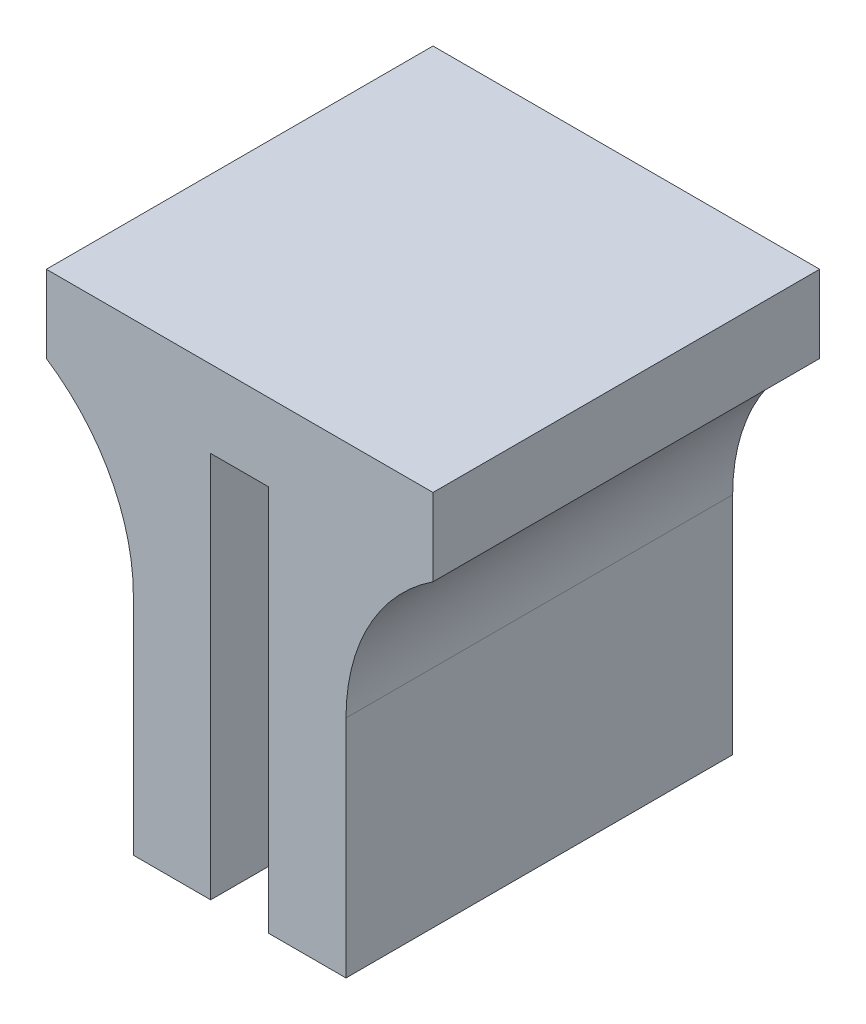
from build123d import *

# Parameters (mm, degrees)
BOSS_EXTRUDE1_DEPTH = 20
FILLET1_R           = 10


with BuildPart() as part:
    # Sketch1 → Boss-Extrude1 (new body)
    with BuildSketch(Plane.XY):
        Polygon((0, 0), (0, 20), (3, 20), (3, 0), (7, 0), (7, 20), (11.5, 20), (11.5, 24), (-8.5, 24), (-8.5, 20), (-4, 20), (-4, 0), align=None)
    extrude(amount=BOSS_EXTRUDE1_DEPTH)

    # Fillet1
    # the kernel refuses this fillet: 10 mm, written as the material it adds along each edge
    with BuildSketch(Plane(origin=(-4, 20, 0), x_dir=(-1.0, -1.533193325383024e-12, 0), z_dir=(0, 0, 1))) as fillet1_piece_1:
        with BuildLine():
            CenterArc((10, 8.351646544), FILLET1_R, 180, 56.632987031)
            Line((0, 8.351646544), (-0.2, 8.351646544))
            Line((-0.2, 8.351646544), (-0.2, 0))
            Line((-0.2, 0), (0, -0.2))
            ThreePointArc((0, -0.2), (2.25, -0.2), (4.39, -0.167032931))
            Line((4.39, -0.167032931), (4.5, 0))
        make_face()
    extrude(amount=20)
    with BuildSketch(Plane(origin=(7, 20, 0), x_dir=(0, -1, 0), z_dir=(0, 0, 1))) as fillet1_piece_2:
        with BuildLine():
            CenterArc((8.351646544, 10), FILLET1_R, 213.367012969, 56.632987031)
            Line((0, 4.5), (-0.167032931, 4.39))
            ThreePointArc((-0.167032931, 4.39), (-0.2, 2.25), (-0.2, 0))
            Line((-0.2, 0), (0, -0.2))
            Line((0, -0.2), (8.351646544, -0.2))
            Line((8.351646544, -0.2), (8.351646544, 0))
        make_face()
    extrude(amount=20)


solid = part.part
